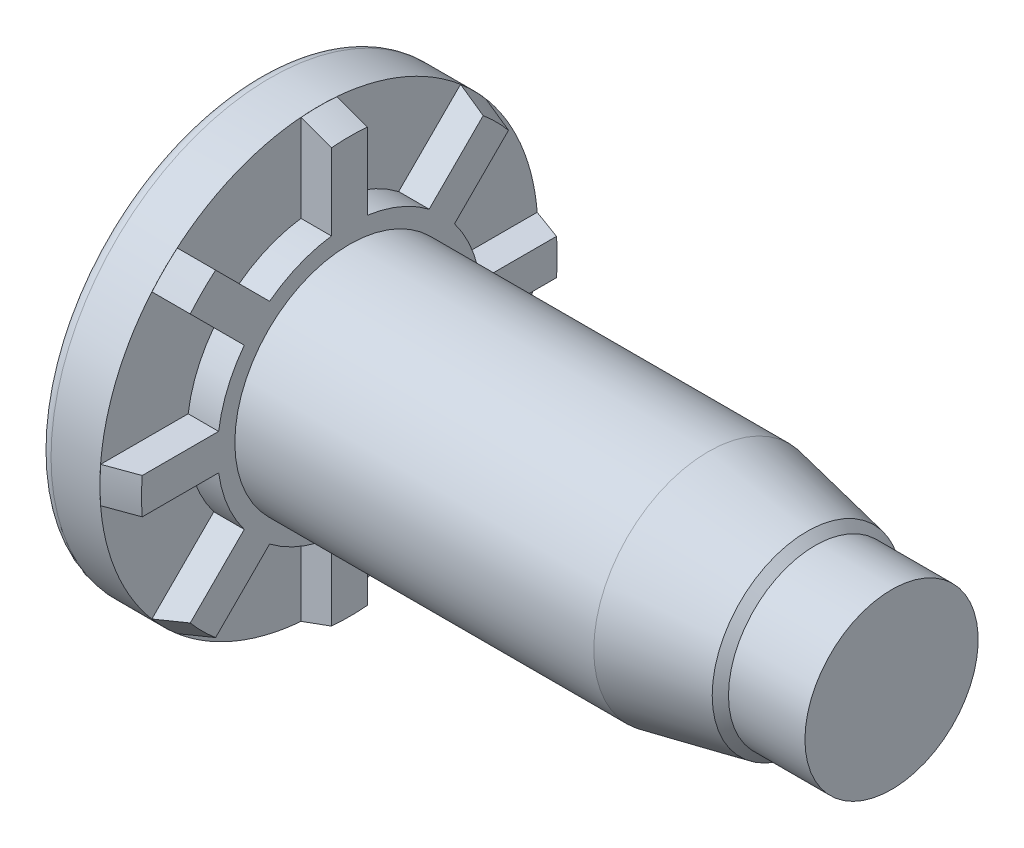
from build123d import *

# Parameters (mm, degrees)
RIBCUT_START     = -1.065
RIBCUT_DEPTH     = 1.065
RIBCUTSPAT_COUNT = 8
RIBCUTSPAT_ANGLE = 315


with BuildPart() as part:
    # BodySke → BaseBody (revolve)
    with BuildSketch(Plane.XY):
        with BuildLine():
            Line((-2.13, 7.224), (-2.13, 0))
            Line((-2.13, 0), (20, 0))
            Line((20, 0), (20, 3.025))
            Line((20, 3.025), (17.33, 3.025))
            Line((17.33, 3.025), (17.0455, 3.3095))
            Line((17.0455, 3.3095), (13.6, 4))
            Line((13.6, 4), (1.065, 4))
            Line((1.065, 4), (1.065, 7.260756185))
            Line((1.065, 7.260756185), (0.00254, 7.64746))
            Line((0.00254, 7.64746), (0, 7.64746))
            Line((0, 7.64746), (0, 7.65))
            Line((0, 7.65), (-1.704, 7.65))
            ThreePointArc((-1.704, 7.65), (-2.005227489, 7.525227489), (-2.13, 7.224))
        make_face()
    revolve(axis=Axis((0, 0, 0), (1, 0, 0)))

    # RibCutSke → RibCut (cut)
    with BuildSketch(Plane(origin=(1.065, 1.794401132, -0.090952894), x_dir=(0, 0, -1), z_dir=(1, 0, 0)).offset(RIBCUT_START)):
        with BuildLine():
            Line((0.534784966, 2.771251969), (0.534784966, 5.829964555))
            ThreePointArc((0.534784966, 5.829964555), (2.836575363, 5.273277291), (4.857824301, 4.039303031))
            Line((4.857824301, 4.039303031), (2.69498789, 1.87646662))
            ThreePointArc((2.69498789, 1.87646662), (1.672579923, 2.463143713), (0.534784966, 2.771251969))
        make_face()
    ribcut = extrude(amount=RIBCUT_DEPTH, mode=Mode.SUBTRACT)

    # RibCutsPat: RibCut ×8 about axis
    ribcutspat_axis = Axis((0, 0, 0), (1, 0, 0))
    for i in range(1, RIBCUTSPAT_COUNT):
        add(ribcut.rotate(ribcutspat_axis, i * RIBCUTSPAT_ANGLE / (RIBCUTSPAT_COUNT - 1)), mode=Mode.SUBTRACT)


solid = part.part
